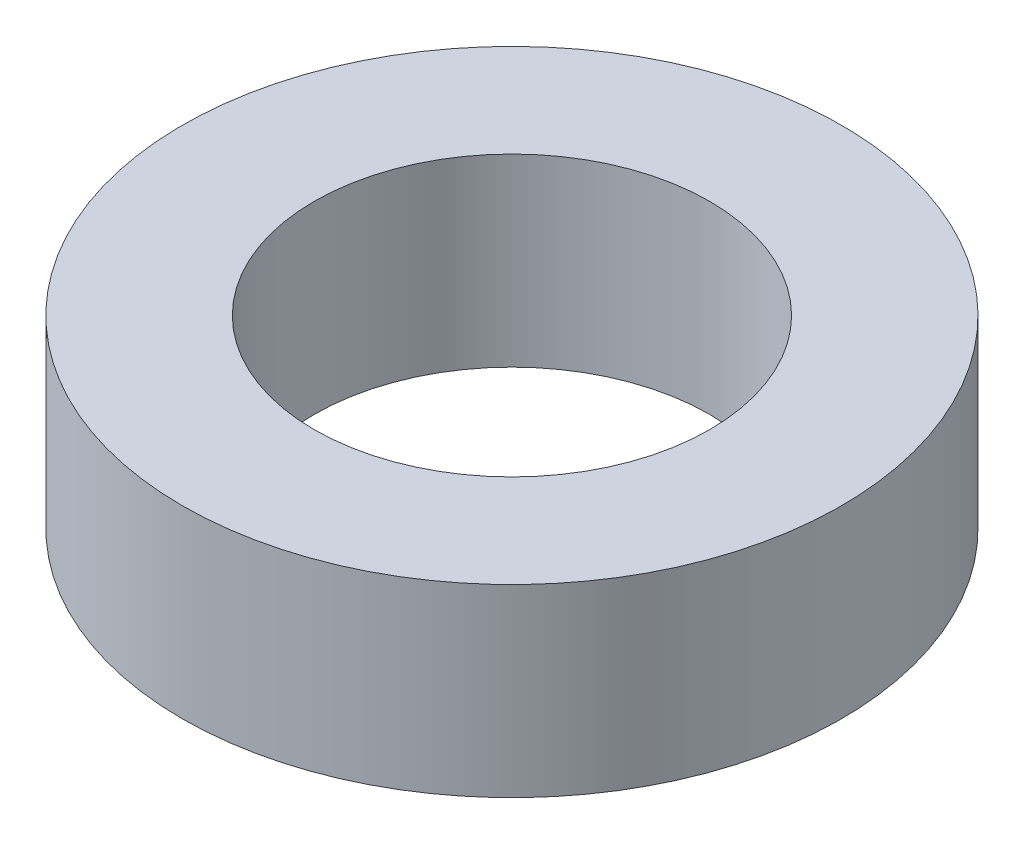
from build123d import *

# Parameters (mm, degrees)
SKETCH1_R           = 50
BOSS_EXTRUDE1_DEPTH = 28
SKETCH2_R           = 30
CUT_EXTRUDE1_DEPTH  = 77.052613367


with BuildPart() as part:
    # Sketch1 → Boss-Extrude1 (new body)
    with BuildSketch(Plane(origin=(0, 0, 0), x_dir=(1, 0, 0), z_dir=(0, 1, 0))):
        Circle(SKETCH1_R)
    extrude(amount=BOSS_EXTRUDE1_DEPTH)

    # Sketch2 → Cut-Extrude1 (cut, through all)
    with BuildSketch(Plane(origin=(0, 0, 0), x_dir=(1, 0, 0), z_dir=(0, 1, 0))):
        Circle(SKETCH2_R)
    extrude(amount=CUT_EXTRUDE1_DEPTH, mode=Mode.SUBTRACT)


solid = part.part
